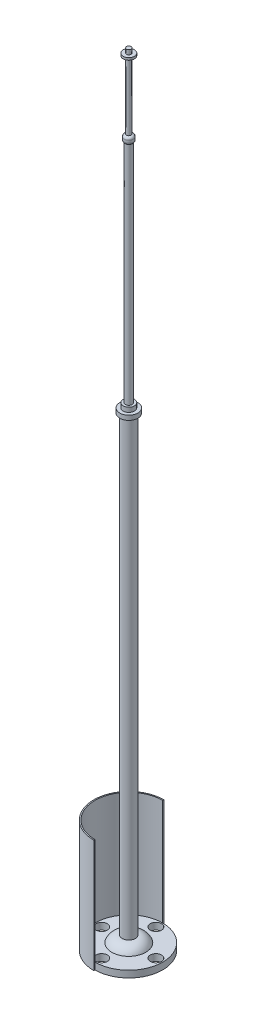
from build123d import *

# Parameters (mm, degrees)
SKETCH1_R            = 15
BOSS_EXTRUDE1_DEPTH  = 3
SKETCH2_R            = 2.5
CUT_EXTRUDE1_DEPTH   = 3
SKETCH3_R            = 7.5
BOSS_EXTRUDE3_DEPTH  = 3
FILLET1_R            = 5
SKETCH4_R            = 2.917424305
BOSS_EXTRUDE4_DEPTH  = 200
SKETCH5_R            = 4
BOSS_EXTRUDE5_DEPTH  = 2
SKETCH6_R            = 2.5
BOSS_EXTRUDE6_DEPTH  = 2
SKETCH7_R            = 1.5
BOSS_EXTRUDE7_DEPTH  = 100
SKETCH8_R            = 2
BOSS_EXTRUDE9_DEPTH  = 3
FILLET4_R            = 1
SKETCH9_R            = 1
BOSS_EXTRUDE10_DEPTH = 30
SKETCH10_R           = 2.5
BOSS_EXTRUDE11_DEPTH = 1
SKETCH11_R           = 1
BOSS_EXTRUDE12_DEPTH = 2
BOSS_EXTRUDE13_DEPTH = 50


with BuildPart() as part:
    # Sketch1 → Boss-Extrude1 (new body)
    with BuildSketch(Plane(origin=(0, 0, 0), x_dir=(1, 0, 0), z_dir=(0, 1, 0))):
        with Locations(Location((0, 0, 0), (0, 0, 270))):
            Circle(SKETCH1_R)
    extrude(amount=BOSS_EXTRUDE1_DEPTH)

    # Sketch2 → Cut-Extrude1 (cut)
    with BuildSketch(Plane(origin=(0, 3, 0), x_dir=(1, 0, 0), z_dir=(0, 1, 0))):
        with Locations(Location((0, 12, 0), (0, 0, 270))):
            Circle(SKETCH2_R)
        with Locations(Location((12, 0, 0), (0, 0, 270))):
            Circle(SKETCH2_R)
        with Locations(Location((0, -12, 0), (0, 0, 270))):
            Circle(SKETCH2_R)
        with Locations(Location((-12, 0, 0), (0, 0, 270))):
            Circle(SKETCH2_R)
    extrude(amount=-CUT_EXTRUDE1_DEPTH, mode=Mode.SUBTRACT)

    # Sketch3 → Boss-Extrude3 (add)
    with BuildSketch(Plane(origin=(0, 3, 0), x_dir=(1, 0, 0), z_dir=(0, 1, 0))):
        with Locations(Location((0, 0, 0), (0, 0, 270))):
            Circle(SKETCH3_R)
    extrude(amount=BOSS_EXTRUDE3_DEPTH)

    # Fillet1
    # the kernel refuses this fillet: 5 mm, written as the material it takes off along each edge
    with BuildSketch(Plane(origin=(0, 6, 0), x_dir=(0, 0, 1), z_dir=(-1, 0, 0))) as fillet1_piece_1:
        with BuildLine():
            CenterArc((2.917424305, -5), FILLET1_R, 23.578178478, 66.421821522)
            Line((2.917424305, 0), (2.917424305, 0.1))
            Line((2.917424305, 0.1), (7.5, 0.1))
            Line((7.5, 0.1), (7.6, 0))
            ThreePointArc((7.6, 0), (7.6, -1.5), (7.591651514, -2.96))
            Line((7.591651514, -2.96), (7.5, -3))
        make_face()
    revolve(axis=Axis((0, 6, 0), (0, 1, 0)), mode=Mode.SUBTRACT)

    # Sketch4 → Boss-Extrude4 (add)
    with BuildSketch(Plane(origin=(0, 6, 0), x_dir=(1, 0, 0), z_dir=(0, 1, 0))):
        with Locations(Location((0, 0, 0), (0, 0, 270))):
            Circle(SKETCH4_R)
    extrude(amount=BOSS_EXTRUDE4_DEPTH)

    # Sketch5 → Boss-Extrude5 (add)
    with BuildSketch(Plane(origin=(0, 206, 0), x_dir=(1, 0, 0), z_dir=(0, 1, 0))):
        with Locations(Location((0, 0, 0), (0, 0, 270))):
            Circle(SKETCH5_R)
    extrude(amount=BOSS_EXTRUDE5_DEPTH)

    # Sketch6 → Boss-Extrude6 (add)
    with BuildSketch(Plane(origin=(0, 208, 0), x_dir=(1, 0, 0), z_dir=(0, 1, 0))):
        with Locations(Location((0, 0, 0), (0, 0, 270))):
            Circle(SKETCH6_R)
    extrude(amount=BOSS_EXTRUDE6_DEPTH)

    # Sketch7 → Boss-Extrude7 (add)
    with BuildSketch(Plane(origin=(0, 210, 0), x_dir=(1, 0, 0), z_dir=(0, 1, 0))):
        with Locations(Location((0, 0, 0), (0, 0, 270))):
            Circle(SKETCH7_R)
    extrude(amount=BOSS_EXTRUDE7_DEPTH)

    # Sketch8 → Boss-Extrude9 (add)
    with BuildSketch(Plane(origin=(0, 310, 0), x_dir=(1, 0, 0), z_dir=(0, 1, 0))):
        with Locations(Location((0, 0, 0), (0, 0, 270))):
            Circle(SKETCH8_R)
    extrude(amount=BOSS_EXTRUDE9_DEPTH)

    # Fillet4
    # the kernel refuses this fillet: 1 mm, written as the material it takes off along each edge
    with BuildSketch(Plane(origin=(0, 310, 0), x_dir=(0, 0, 1), z_dir=(-1, 0, 0))) as fillet4_piece_1:
        with BuildLine():
            CenterArc((1, 0.866025404), FILLET4_R, 300, 60)
            Line((1.5, 0), (1.51, -0.017320508))
            ThreePointArc((1.51, -0.017320508), (1.75, -0.02), (2, -0.02))
            Line((2, -0.02), (2.02, 0))
            Line((2.02, 0), (2.02, 0.866025404))
            Line((2.02, 0.866025404), (2, 0.866025404))
        make_face()
    revolve(axis=Axis((0, 310, 0), (0, 1, 0)), mode=Mode.SUBTRACT)
    with BuildSketch(Plane(origin=(0, 313, 0), x_dir=(0, 0, 1), z_dir=(-1, 0, 0))) as fillet4_piece_2:
        with BuildLine():
            CenterArc((2 - FILLET4_R, -FILLET4_R), FILLET4_R, 0, 90)
            Line((2 - FILLET4_R, 0), (2 - FILLET4_R, FILLET4_R * 0.02))
            Line((2 - FILLET4_R, FILLET4_R * 0.02), (2 + FILLET4_R * 0.02, FILLET4_R * 0.02))
            Line((2 + FILLET4_R * 0.02, FILLET4_R * 0.02), (2 + FILLET4_R * 0.02, -FILLET4_R))
            Line((2 + FILLET4_R * 0.02, -FILLET4_R), (2, -FILLET4_R))
        make_face()
    revolve(axis=Axis((0, 313, 0), (0, 1, 0)), mode=Mode.SUBTRACT)

    # Sketch9 → Boss-Extrude10 (add)
    with BuildSketch(Plane(origin=(0, 313, 0), x_dir=(1, 0, 0), z_dir=(0, 1, 0))):
        with Locations(Location((0, 0, 0), (0, 0, 270))):
            Circle(SKETCH9_R)
    extrude(amount=BOSS_EXTRUDE10_DEPTH)

    # Sketch10 → Boss-Extrude11 (add)
    with BuildSketch(Plane(origin=(0, 343, 0), x_dir=(1, 0, 0), z_dir=(0, 1, 0))):
        with Locations(Location((0, 0, 0), (0, 0, 270))):
            Circle(SKETCH10_R)
    extrude(amount=BOSS_EXTRUDE11_DEPTH)

    # Sketch11 → Boss-Extrude12 (add)
    with BuildSketch(Plane(origin=(0, 344, 0), x_dir=(1, 0, 0), z_dir=(0, 1, 0))):
        with Locations(Location((0, 0, 0), (0, 0, 270))):
            Circle(SKETCH11_R)
    extrude(amount=BOSS_EXTRUDE12_DEPTH)

    # Sketch12 → Boss-Extrude13 (add)
    with BuildSketch(Plane.XZ):
        with BuildLine():
            Line((0, 15), (0, 15.5))
            ThreePointArc((0, 15.5), (-15.5, 0), (0, -15.5))
            Line((0, -15.5), (0, -15))
            ThreePointArc((0, -15), (-15, 0), (0, 15))
        make_face()
    extrude(amount=-BOSS_EXTRUDE13_DEPTH)


solid = part.part
